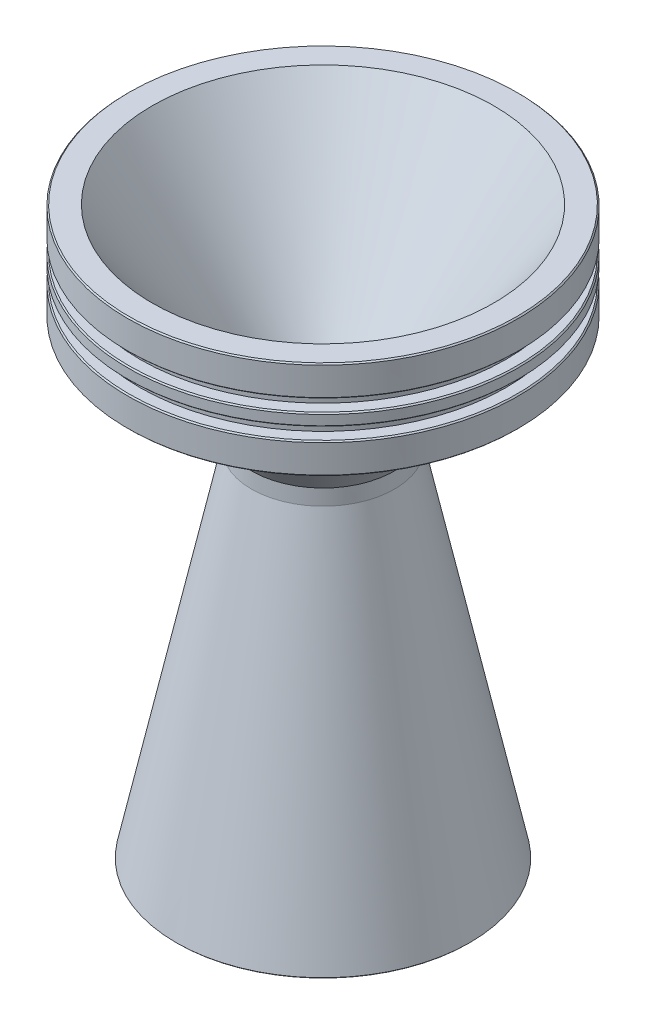
from build123d import *
from OCP.BRepFilletAPI import BRepFilletAPI_MakeChamfer

# Parameters (mm, degrees)
OUTER_CHAMFERS_SIZE  = 0.127
OUTER_CHAMFERS_SIZE2 = 0.107077278


with BuildPart() as part:
    # Sketch1 → base_revolve (revolve)
    with BuildSketch(Plane.XY):
        Polygon((0, 0), (2.54, 0), (16.129, -19.407103264), (16.129, -21.947103264), (8.255, -58.991360746), (5.009068611, -58.991360746), (12.883068611, -21.947103264), (12.883068611, -20.306876397), (5.778149269, -10.16), (0, -10.16), (0, -6.985), (1.27, -6.985), (1.27, -5.715), (0, -5.715), (0, -4.445), (1.27, -4.445), (1.27, -3.175), (0, -3.175), align=None)
    revolve(axis=Axis((20.32, 0, 0), (0, -1, 0)))

    # outer_chamfers: one chamfer whose edges measure the first distance from different faces: ONE call of the kernel's chamfer builder (chamfer() names one face for all edges)
    outer_chamfers_edges_1 = [part.edges().sort_by_distance(p)[0] for p in [
        (40.64, -10.16, 0),
        (40.64, 0, 0),
        (40.64, -5.715, 0),
        (40.64, -6.985, 0),
        (40.64, -4.445, 0),
        (40.64, -3.175, 0),
    ]]
    outer_chamfers_edges_2 = [part.edges().sort_by_distance(p)[0] for p in [
        (35.630931389, -58.991360746, 0),
    ]]
    outer_chamfers_side_2 = [part.faces().sort_by_distance(p)[0] for p in [
        (32.818058536, -58.991360746, 0),
    ]]
    outer_chamfers = BRepFilletAPI_MakeChamfer(part.part.solid().wrapped)
    for e in outer_chamfers_edges_1:
        outer_chamfers.Add(OUTER_CHAMFERS_SIZE, e.wrapped)
    for e in outer_chamfers_edges_2:
        outer_chamfers.Add(OUTER_CHAMFERS_SIZE, OUTER_CHAMFERS_SIZE2, e.wrapped, outer_chamfers_side_2[0].wrapped)  # the first distance lies on this face
    add(Compound.cast(outer_chamfers.Shape()), mode=Mode.REPLACE)


solid = part.part
